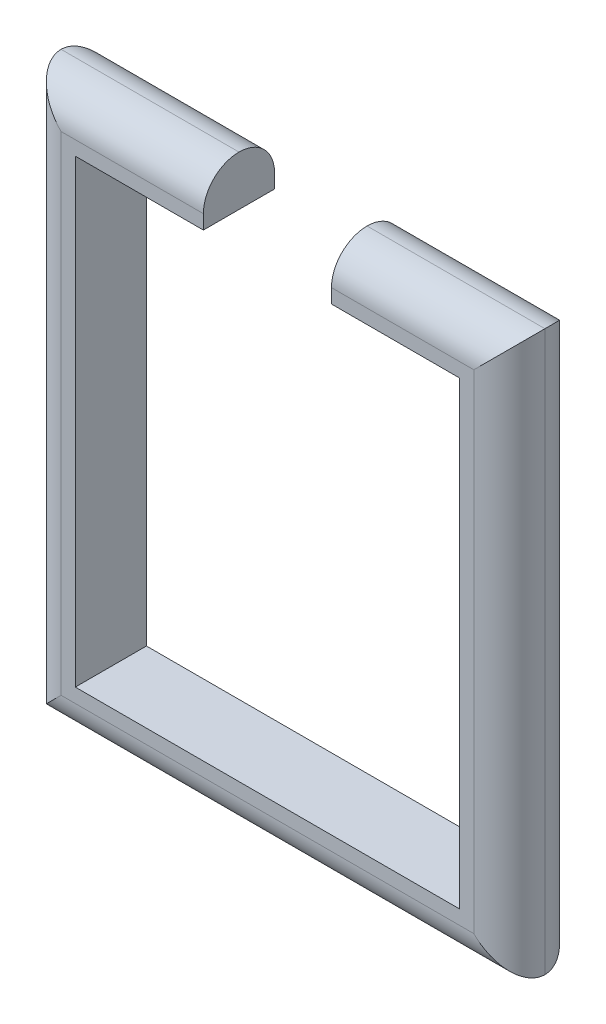
from build123d import *

# Parameters (mm, degrees)
BOSS_EXTRUDE1_DEPTH = 127
FILLET2_R           = 63.5


with BuildPart() as part:
    # Sketch1 → Boss-Extrude1 (new body)
    with BuildSketch(Plane.XY):
        Polygon((-84.386835568, -262.623028831), (-84.386835568, -173.723028831), (-401.886835568, -173.723028831), (-401.886835568, -1172.197028831), (461.713164432, -1172.197028831), (461.713164432, -173.723028831), (144.213164432, -173.723028831), (144.213164432, -262.623028831), (372.813164432, -262.623028831), (372.813164432, -1083.297028831), (-312.986835568, -1083.297028831), (-312.986835568, -262.623028831), align=None)
    extrude(amount=BOSS_EXTRUDE1_DEPTH)

    # Fillet2
    fillet2_edges = [part.edges().sort_by_distance(p)[0] for p in [
        (302.963164432, -173.723028831, 0),
        (302.963164432, -173.723028831, 127),
        (-243.136835568, -173.723028831, 0),
        (-243.136835568, -173.723028831, 127),
        (-401.886835568, -672.960028831, 127),
        (-401.886835568, -672.960028831, 0),
        (461.713164432, -672.960028831, 127),
        (461.713164432, -672.960028831, 0),
        (29.913164432, -1172.197028831, 0),
        (29.913164432, -1172.197028831, 127),
    ]]
    fillet(fillet2_edges, radius=FILLET2_R - 0.0001)  # a hair under: the kernel refuses the full size


solid = part.part
